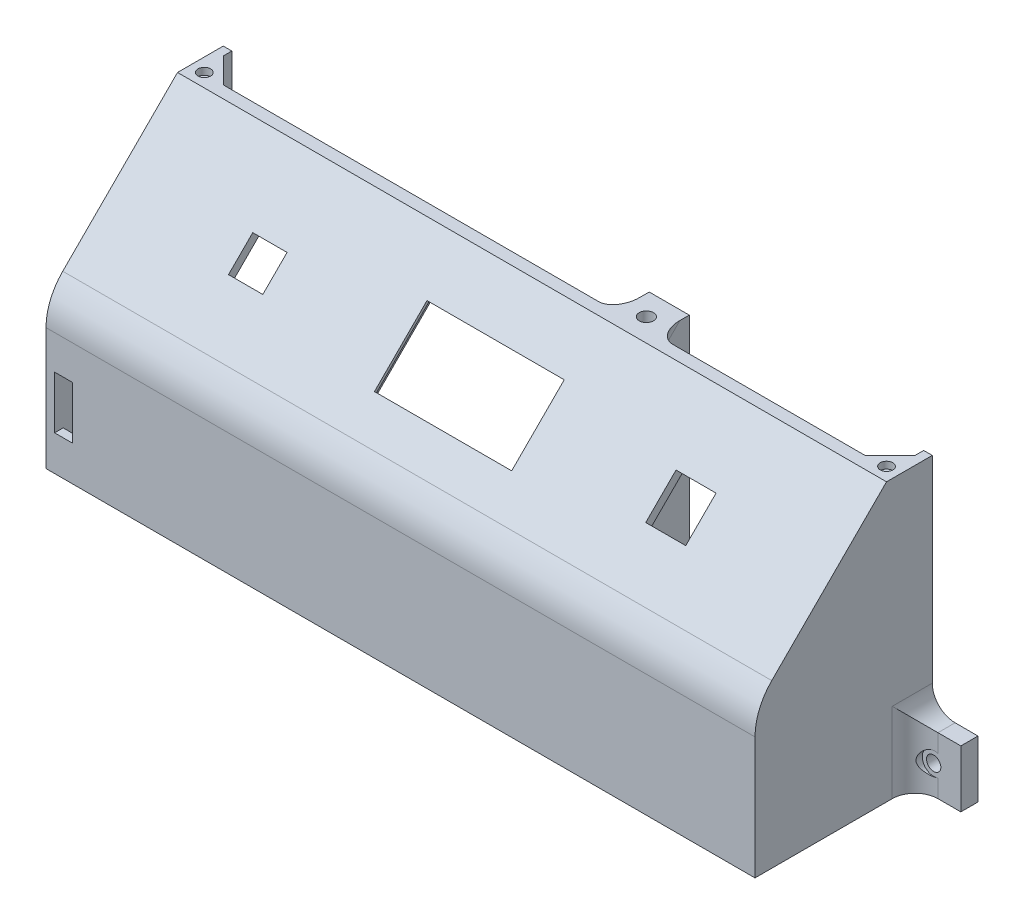
from build123d import *

# Parameters (mm, degrees)
SKETCH1_W           = 124
SKETCH1_H           = 31
BOSS_EXTRUDE1_DEPTH = 50
CUT_EXTRUDE1_DEPTH  = 138.247950804
CUT_EXTRUDE2_DEPTH  = 121
SKETCH4_W           = 2.5
SKETCH4_H           = 5
BOSS_EXTRUDE2_DEPTH = 5
SKETCH5_W           = 24
SKETCH5_H           = 13
SKETCH5_W_2         = 7
SKETCH5_H_2         = 7.5
SKETCH5_W_3         = 6
SKETCH5_H_3         = 6
CUT_EXTRUDE3_DEPTH  = 4
SKETCH6_W           = 3.5
SKETCH6_H           = 19
BOSS_EXTRUDE3_DEPTH = 3.5
SKETCH8_W           = 2.2
SKETCH8_H           = 9
BOSS_EXTRUDE4_DEPTH = 8
FILLET1_R           = 3
SKETCH7_W           = 3.1
SKETCH7_H           = 9.2
CUT_EXTRUDE4_DEPTH  = 8
SKETCH10_W          = 8
SKETCH10_H          = 10
BOSS_EXTRUDE5_DEPTH = 3
FILLET4_R           = 4
SKETCH13_R          = 1.25
CUT_EXTRUDE6_DEPTH  = 5
SKETCH14_R          = 2
CUT_EXTRUDE7_DEPTH  = 5
SKETCH17_W          = 7
SKETCH17_H          = 7
BOSS_EXTRUDE7_DEPTH = 47
SKETCH18_R          = 1.25
CUT_EXTRUDE9_DEPTH  = 5
FILLET5_R           = 3
FILLET6_R           = 10
FILLET8_R           = 3
CUT_EXTRUDE10_DEPTH = 1
SKETCH21_W          = 4.4
SKETCH21_H          = 5
BOSS_EXTRUDE8_DEPTH = 2
CUT_EXTRUDE12_DEPTH = 8
CUT_EXTRUDE13_DEPTH = 1
SKETCH26_R          = 1.1
CUT_EXTRUDE14_DEPTH = 1.2
FILLET10_R          = 1.2


with BuildPart() as part:
    # Sketch1 → Boss-Extrude1 (new body)
    with BuildSketch(Plane(origin=(0, 0, 0), x_dir=(1, 0, 0), z_dir=(0, 1, 0))):
        with Locations((62, 15.5)):
            Rectangle(SKETCH1_W, SKETCH1_H)
    extrude(amount=BOSS_EXTRUDE1_DEPTH)

    # Sketch2 → Cut-Extrude1 (cut, through all)
    with BuildSketch(Plane.ZY):
        Polygon((-23, 48.5), (0, 25.5), (0, 50), (-31, 50), (-31, 48.5), align=None)
    extrude(amount=-CUT_EXTRUDE1_DEPTH, mode=Mode.SUBTRACT)

    # Sketch3 → Cut-Extrude2 (cut)
    with BuildSketch(Plane.ZY.offset(-1.5)):
        Polygon((-31, 48.5), (-25.121320344, 48.5), (-1.5, 24.878679656), (-1.5, 1.5), (-31, 1.5), align=None)
    extrude(amount=-CUT_EXTRUDE2_DEPTH, mode=Mode.SUBTRACT)

    # Sketch4 → Boss-Extrude2 (add)
    with BuildSketch(Plane(origin=(0, 1.5, 0), x_dir=(1, 0, 0), z_dir=(0, 1, 0))):
        Polygon((84, 24), (84, 1.5), (81.5, 1.5), (81.5, 26.5), (122.5, 26.5), (122.5, 24), align=None)
        Polygon((60, 13.5), (60, 22), (29.5, 22), (27, 22), (27, 24.5), (62.5, 24.5), (62.5, 13.5), align=None)
        with Locations((28.25, 4)):
            Rectangle(SKETCH4_W, SKETCH4_H)
    extrude(amount=BOSS_EXTRUDE2_DEPTH)

    # Sketch5 → Cut-Extrude3 (cut)
    with BuildSketch(Plane(origin=(0, 12.75, 12.75), x_dir=(1, 0, 0), z_dir=(0, 0.7071067811865438, 0.7071067811865513))):
        with Locations((62, 35.058134855)):
            Rectangle(SKETCH5_W, SKETCH5_H)
        with Locations((99, 35.058134855)):
            Rectangle(SKETCH5_W_2, SKETCH5_H_2)
        with Locations((25, 35.058134855)):
            Rectangle(SKETCH5_W_3, SKETCH5_H_3)
    extrude(amount=-CUT_EXTRUDE3_DEPTH, mode=Mode.SUBTRACT)

    # Sketch6 → Boss-Extrude3 (add)
    with BuildSketch(Plane(origin=(0, 1.5, 0), x_dir=(1, 0, 0), z_dir=(0, 1, 0))):
        with Locations((7.65, 11)):
            Rectangle(SKETCH6_W, SKETCH6_H)
    extrude(amount=BOSS_EXTRUDE3_DEPTH)

    # Sketch8 → Boss-Extrude4 (add)
    with BuildSketch(Plane(origin=(0, 5, 0), x_dir=(1, 0, 0), z_dir=(0, 1, 0))):
        with Locations((8.3, 14)):
            Rectangle(SKETCH8_W, SKETCH8_H)
    extrude(amount=BOSS_EXTRUDE4_DEPTH)

    # Fillet1
    # the kernel refuses this fillet: 3 mm, written as the material it adds along each edge
    with BuildSketch(Plane(origin=(9.4, 1.5, -20.5), x_dir=(1, 0, 0), z_dir=(0, 0, 1))) as fillet1_piece_1:
        with BuildLine():
            CenterArc((FILLET1_R, FILLET1_R), FILLET1_R, 180, 90)
            Line((0, FILLET1_R), (-FILLET1_R * 0.02, FILLET1_R))
            Line((-FILLET1_R * 0.02, FILLET1_R), (-FILLET1_R * 0.02, -FILLET1_R * 0.02))
            Line((-FILLET1_R * 0.02, -FILLET1_R * 0.02), (FILLET1_R, -FILLET1_R * 0.02))
            Line((FILLET1_R, -FILLET1_R * 0.02), (FILLET1_R, 0))
        make_face()
    extrude(amount=19)
    with BuildSketch(Plane(origin=(7.2, 5, -18.5), x_dir=(0, 0, -1), z_dir=(1, 0, 0))) as fillet1_piece_2:
        with BuildLine():
            CenterArc((3, 2.828427125), FILLET1_R, 180, 70.528779366)
            Line((0, 2.828427125), (-0.06, 2.828427125))
            Line((-0.06, 2.828427125), (-0.06, 0))
            Line((-0.06, 0), (0, -0.06))
            ThreePointArc((0, -0.06), (1, -0.06), (1.98, -0.056568542))
            Line((1.98, -0.056568542), (2, 0))
        make_face()
    extrude(amount=2.2)
    with BuildSketch(Plane(origin=(9.4, 5, -9.5), x_dir=(0, 0, 1), z_dir=(-1, 0, 0))) as fillet1_piece_3:
        with BuildLine():
            CenterArc((FILLET1_R, FILLET1_R), FILLET1_R, 180, 90)
            Line((0, FILLET1_R), (-FILLET1_R * 0.02, FILLET1_R))
            Line((-FILLET1_R * 0.02, FILLET1_R), (-FILLET1_R * 0.02, -FILLET1_R * 0.02))
            Line((-FILLET1_R * 0.02, -FILLET1_R * 0.02), (FILLET1_R, -FILLET1_R * 0.02))
            Line((FILLET1_R, -FILLET1_R * 0.02), (FILLET1_R, 0))
        make_face()
    extrude(amount=2.2)
    with BuildSketch(Plane(origin=(81.5, 1.5, -26.5), x_dir=(0, 0, -1), z_dir=(1, 0, 0))) as fillet1_piece_4:
        with BuildLine():
            CenterArc((FILLET1_R, FILLET1_R), FILLET1_R, 180, 90)
            Line((0, FILLET1_R), (-FILLET1_R * 0.02, FILLET1_R))
            Line((-FILLET1_R * 0.02, FILLET1_R), (-FILLET1_R * 0.02, -FILLET1_R * 0.02))
            Line((-FILLET1_R * 0.02, -FILLET1_R * 0.02), (FILLET1_R, -FILLET1_R * 0.02))
            Line((FILLET1_R, -FILLET1_R * 0.02), (FILLET1_R, 0))
        make_face()
    extrude(amount=41)
    with BuildSketch(Plane(origin=(81.5, 1.5, -1.5), x_dir=(-1, 0, 0), z_dir=(0, 0, -1))) as fillet1_piece_5:
        with BuildLine():
            CenterArc((FILLET1_R, FILLET1_R), FILLET1_R, 180, 90)
            Line((0, FILLET1_R), (-FILLET1_R * 0.02, FILLET1_R))
            Line((-FILLET1_R * 0.02, FILLET1_R), (-FILLET1_R * 0.02, -FILLET1_R * 0.02))
            Line((-FILLET1_R * 0.02, -FILLET1_R * 0.02), (FILLET1_R, -FILLET1_R * 0.02))
            Line((FILLET1_R, -FILLET1_R * 0.02), (FILLET1_R, 0))
        make_face()
    extrude(amount=25)
    with BuildSketch(Plane(origin=(62.5, 1.5, -24.5), x_dir=(1, 0, 0), z_dir=(0, 0, 1))) as fillet1_piece_6:
        with BuildLine():
            CenterArc((FILLET1_R, FILLET1_R), FILLET1_R, 180, 90)
            Line((0, FILLET1_R), (-FILLET1_R * 0.02, FILLET1_R))
            Line((-FILLET1_R * 0.02, FILLET1_R), (-FILLET1_R * 0.02, -FILLET1_R * 0.02))
            Line((-FILLET1_R * 0.02, -FILLET1_R * 0.02), (FILLET1_R, -FILLET1_R * 0.02))
            Line((FILLET1_R, -FILLET1_R * 0.02), (FILLET1_R, 0))
        make_face()
    extrude(amount=11)
    with BuildSketch(Plane(origin=(27, 1.5, -24.5), x_dir=(0, 0, -1), z_dir=(1, 0, 0))) as fillet1_piece_7:
        with BuildLine():
            CenterArc((FILLET1_R, FILLET1_R), FILLET1_R, 180, 90)
            Line((0, FILLET1_R), (-FILLET1_R * 0.02, FILLET1_R))
            Line((-FILLET1_R * 0.02, FILLET1_R), (-FILLET1_R * 0.02, -FILLET1_R * 0.02))
            Line((-FILLET1_R * 0.02, -FILLET1_R * 0.02), (FILLET1_R, -FILLET1_R * 0.02))
            Line((FILLET1_R, -FILLET1_R * 0.02), (FILLET1_R, 0))
        make_face()
    extrude(amount=35.5)
    with BuildSketch(Plane(origin=(27, 1.5, -22), x_dir=(-1, 0, 0), z_dir=(0, 0, -1))) as fillet1_piece_8:
        with BuildLine():
            CenterArc((FILLET1_R, FILLET1_R), FILLET1_R, 180, 90)
            Line((0, FILLET1_R), (-FILLET1_R * 0.02, FILLET1_R))
            Line((-FILLET1_R * 0.02, FILLET1_R), (-FILLET1_R * 0.02, -FILLET1_R * 0.02))
            Line((-FILLET1_R * 0.02, -FILLET1_R * 0.02), (FILLET1_R, -FILLET1_R * 0.02))
            Line((FILLET1_R, -FILLET1_R * 0.02), (FILLET1_R, 0))
        make_face()
    extrude(amount=2.5)
    with BuildSketch(Plane(origin=(27, 1.5, -6.5), x_dir=(-1, 0, 0), z_dir=(0, 0, 1))) as fillet1_piece_9:
        with BuildLine():
            CenterArc((FILLET1_R, -FILLET1_R), FILLET1_R, 90, 90)
            Line((0, -FILLET1_R), (-FILLET1_R * 0.02, -FILLET1_R))
            Line((-FILLET1_R * 0.02, -FILLET1_R), (-FILLET1_R * 0.02, FILLET1_R * 0.02))
            Line((-FILLET1_R * 0.02, FILLET1_R * 0.02), (FILLET1_R, FILLET1_R * 0.02))
            Line((FILLET1_R, FILLET1_R * 0.02), (FILLET1_R, 0))
        make_face()
    extrude(amount=5)
    with BuildSketch(Plane(origin=(74, 1.5, -26.5), x_dir=(0, 0, -1), z_dir=(1, 0, 0))) as fillet1_piece_10a_section:
        with BuildLine():
            CenterArc((FILLET1_R, FILLET1_R), FILLET1_R, 180, 90)
            Line((0, FILLET1_R), (-FILLET1_R * 0.02, FILLET1_R))
            Line((-FILLET1_R * 0.02, FILLET1_R), (-FILLET1_R * 0.02, -FILLET1_R * 0.02))
            Line((-FILLET1_R * 0.02, -FILLET1_R * 0.02), (FILLET1_R, -FILLET1_R * 0.02))
            Line((FILLET1_R, -FILLET1_R * 0.02), (FILLET1_R, 0))
        make_face()
    fillet1_piece_10a = extrude(amount=48.5, mode=Mode.PRIVATE)
    fillet1_piece_10a = split(fillet1_piece_10a, bisect_by=Plane(origin=(81.5, 2.179185343, -27.179185343), z_dir=(-1, 0, 0)), keep=Keep.TOP, mode=Mode.PRIVATE)
    with BuildSketch(Plane(origin=(81.5, 1.5, -1.5), x_dir=(-1, 0, 0), z_dir=(0, 0, -1))) as fillet1_piece_10b_section:
        with BuildLine():
            CenterArc((FILLET1_R, FILLET1_R), FILLET1_R, 180, 90)
            Line((0, FILLET1_R), (-FILLET1_R * 0.02, FILLET1_R))
            Line((-FILLET1_R * 0.02, FILLET1_R), (-FILLET1_R * 0.02, -FILLET1_R * 0.02))
            Line((-FILLET1_R * 0.02, -FILLET1_R * 0.02), (FILLET1_R, -FILLET1_R * 0.02))
            Line((FILLET1_R, -FILLET1_R * 0.02), (FILLET1_R, 0))
        make_face()
    fillet1_piece_10b = extrude(amount=32.5, mode=Mode.PRIVATE)
    fillet1_piece_10b = split(fillet1_piece_10b, bisect_by=Plane(origin=(80.820814657, 2.179185343, -31), z_dir=(0, 0, 1)), keep=Keep.TOP, mode=Mode.PRIVATE)
    fillet1_piece_10b = split(fillet1_piece_10b, bisect_by=Plane(origin=(80.820814657, 2.179185343, -26.5), z_dir=(0, 0, -1)), keep=Keep.TOP, mode=Mode.PRIVATE)
    fillet1_piece_10 = fillet1_piece_10a & fillet1_piece_10b
    add(fillet1_piece_10)
    with BuildSketch(Plane(origin=(62.5, 1.5, -32), x_dir=(1, 0, 0), z_dir=(0, 0, 1))) as fillet1_piece_11a_section:
        with BuildLine():
            CenterArc((FILLET1_R, FILLET1_R), FILLET1_R, 180, 90)
            Line((0, FILLET1_R), (-FILLET1_R * 0.02, FILLET1_R))
            Line((-FILLET1_R * 0.02, FILLET1_R), (-FILLET1_R * 0.02, -FILLET1_R * 0.02))
            Line((-FILLET1_R * 0.02, -FILLET1_R * 0.02), (FILLET1_R, -FILLET1_R * 0.02))
            Line((FILLET1_R, -FILLET1_R * 0.02), (FILLET1_R, 0))
        make_face()
    fillet1_piece_11a = extrude(amount=18.5, mode=Mode.PRIVATE)
    fillet1_piece_11a = split(fillet1_piece_11a, bisect_by=Plane(origin=(63.179185343, 2.179185343, -31), z_dir=(0, 0, 1)), keep=Keep.TOP, mode=Mode.PRIVATE)
    fillet1_piece_11a = split(fillet1_piece_11a, bisect_by=Plane(origin=(63.179185343, 2.179185343, -24.5), z_dir=(0, 0, -1)), keep=Keep.TOP, mode=Mode.PRIVATE)
    with BuildSketch(Plane(origin=(27, 1.5, -24.5), x_dir=(0, 0, -1), z_dir=(1, 0, 0))) as fillet1_piece_11b_section:
        with BuildLine():
            CenterArc((FILLET1_R, FILLET1_R), FILLET1_R, 180, 90)
            Line((0, FILLET1_R), (-FILLET1_R * 0.02, FILLET1_R))
            Line((-FILLET1_R * 0.02, FILLET1_R), (-FILLET1_R * 0.02, -FILLET1_R * 0.02))
            Line((-FILLET1_R * 0.02, -FILLET1_R * 0.02), (FILLET1_R, -FILLET1_R * 0.02))
            Line((FILLET1_R, -FILLET1_R * 0.02), (FILLET1_R, 0))
        make_face()
    fillet1_piece_11b = extrude(amount=43, mode=Mode.PRIVATE)
    fillet1_piece_11b = split(fillet1_piece_11b, bisect_by=Plane(origin=(62.5, 2.179185343, -25.179185343), z_dir=(1, 0, 0)), keep=Keep.TOP, mode=Mode.PRIVATE)
    fillet1_piece_11 = fillet1_piece_11a & fillet1_piece_11b
    add(fillet1_piece_11)
    with BuildSketch(Plane(origin=(19.5, 1.5, -24.5), x_dir=(0, 0, -1), z_dir=(1, 0, 0))) as fillet1_piece_12a_section:
        with BuildLine():
            CenterArc((FILLET1_R, FILLET1_R), FILLET1_R, 180, 90)
            Line((0, FILLET1_R), (-FILLET1_R * 0.02, FILLET1_R))
            Line((-FILLET1_R * 0.02, FILLET1_R), (-FILLET1_R * 0.02, -FILLET1_R * 0.02))
            Line((-FILLET1_R * 0.02, -FILLET1_R * 0.02), (FILLET1_R, -FILLET1_R * 0.02))
            Line((FILLET1_R, -FILLET1_R * 0.02), (FILLET1_R, 0))
        make_face()
    fillet1_piece_12a = extrude(amount=43, mode=Mode.PRIVATE)
    fillet1_piece_12a = split(fillet1_piece_12a, bisect_by=Plane(origin=(27, 2.179185343, -25.179185343), z_dir=(-1, 0, 0)), keep=Keep.TOP, mode=Mode.PRIVATE)
    with BuildSketch(Plane(origin=(27, 1.5, -22), x_dir=(-1, 0, 0), z_dir=(0, 0, -1))) as fillet1_piece_12b_section:
        with BuildLine():
            CenterArc((FILLET1_R, FILLET1_R), FILLET1_R, 180, 90)
            Line((0, FILLET1_R), (-FILLET1_R * 0.02, FILLET1_R))
            Line((-FILLET1_R * 0.02, FILLET1_R), (-FILLET1_R * 0.02, -FILLET1_R * 0.02))
            Line((-FILLET1_R * 0.02, -FILLET1_R * 0.02), (FILLET1_R, -FILLET1_R * 0.02))
            Line((FILLET1_R, -FILLET1_R * 0.02), (FILLET1_R, 0))
        make_face()
    fillet1_piece_12b = extrude(amount=10, mode=Mode.PRIVATE)
    fillet1_piece_12b = split(fillet1_piece_12b, bisect_by=Plane(origin=(26.320814657, 2.179185343, -31), z_dir=(0, 0, 1)), keep=Keep.TOP, mode=Mode.PRIVATE)
    fillet1_piece_12b = split(fillet1_piece_12b, bisect_by=Plane(origin=(26.320814657, 2.179185343, -24.5), z_dir=(0, 0, -1)), keep=Keep.TOP, mode=Mode.PRIVATE)
    fillet1_piece_12 = fillet1_piece_12a & fillet1_piece_12b
    add(fillet1_piece_12)

    # Sketch7 → Cut-Extrude4 (cut)
    with BuildSketch(Plane(origin=(0, 0, -1.5), x_dir=(-1, 0, 0), z_dir=(0, 0, -1))):
        with Locations((-3.05, 10.77)):
            Rectangle(SKETCH7_W, SKETCH7_H)
    extrude(amount=-CUT_EXTRUDE4_DEPTH, mode=Mode.SUBTRACT)

    # Sketch10 → Boss-Extrude5 (add)
    with BuildSketch(Plane(origin=(0, 0, -31), x_dir=(-1, 0, 0), z_dir=(0, 0, -1))):
        with Locations((-128, 5)):
            Rectangle(SKETCH10_W, SKETCH10_H)
        with Locations((4, 5)):
            Rectangle(SKETCH10_W, SKETCH10_H)
    extrude(amount=-BOSS_EXTRUDE5_DEPTH)

    # Fillet4
    fillet4_edges = [part.edges().sort_by_distance(p)[0] for p in [
        (124, 5, -28),
        (124, 10, -29.5),
        (0, 5, -28),
        (0, 10, -29.5),
    ]]
    fillet(fillet4_edges, radius=FILLET4_R)

    # Sketch13 → Cut-Extrude6 (cut)
    with BuildSketch(Plane(origin=(0, 0, -31), x_dir=(-1, 0, 0), z_dir=(0, 0, -1))):
        with Locations((3.25, 5)):
            Circle(SKETCH13_R)
        with Locations((-127.25, 5)):
            Circle(SKETCH13_R)
    extrude(amount=-CUT_EXTRUDE6_DEPTH, mode=Mode.SUBTRACT)

    # Sketch14 → Cut-Extrude7 (cut)
    with BuildSketch(Plane.XY.offset(-28)):
        with Locations((-3.25, 5)):
            Circle(SKETCH14_R)
        with Locations((127.25, 5)):
            Circle(SKETCH14_R)
    extrude(amount=CUT_EXTRUDE7_DEPTH, mode=Mode.SUBTRACT)

    # Sketch17 → Boss-Extrude7 (add, through all)
    with BuildSketch(Plane(origin=(0, 1.5, 0), x_dir=(1, 0, 0), z_dir=(0, 1, 0))):
        with Locations((78, 27.5)):
            Rectangle(SKETCH17_W, SKETCH17_H)
    extrude(amount=BOSS_EXTRUDE7_DEPTH)

    # Sketch18 → Cut-Extrude9 (cut)
    with BuildSketch(Plane(origin=(0, 48.5, 0), x_dir=(1, 0, 0), z_dir=(0, 1, 0))):
        with Locations(Location((78, 27, 0), (0, 0, 270))):
            Circle(SKETCH18_R)
    extrude(amount=-CUT_EXTRUDE9_DEPTH, mode=Mode.SUBTRACT)

    # Fillet5
    fillet5_edges = [part.edges().sort_by_distance(p)[0] for p in [
        (74.5, 47.939339828, -24.560660172),
        (81.5, 47.939339828, -24.560660172),
        (81.5, 5.5, -24),
        (80.621320344, 2.378679656, -24),
        (76.5, 1.5, -24),
        (74.5, 1.5, -27.5),
    ]]
    fillet(fillet5_edges, radius=FILLET5_R)

    # Fillet6
    fillet6_edges = [part.edges().sort_by_distance(p)[0] for p in [
        (62, 25.5, 0),
    ]]
    fillet(fillet6_edges, radius=FILLET6_R)

    # Fillet8
    fillet8_edges = [part.edges().sort_by_distance(p)[0] for p in [
        (122.5, 36.689339828, -13.310660172),
        (62, 24.878679656, -1.5),
    ]]
    fillet(fillet8_edges, radius=FILLET8_R)

    # Sketch19 → Cut-Extrude10 (cut)
    with BuildSketch(Plane(origin=(0, 11.689339828, 11.689339828), x_dir=(1, 0, 0), z_dir=(0, -0.7071067811865438, -0.7071067811865513))):
        Polygon((74.5, -41.558134855), (68, -41.558134855), (68, -46.558134855), (56, -46.558134855), (56, -41.558134855), (49.5, -41.558134855), (49.5, -24.558134855), (55.5, -24.558134855), (55.5, -19.895183951), (68.5, -19.895183951), (68.5, -24.558134855), (74.5, -24.558134855), align=None)
    extrude(amount=-CUT_EXTRUDE10_DEPTH, mode=Mode.SUBTRACT)

    # Sketch21 → Boss-Extrude8 (add)
    with BuildSketch(Plane(origin=(0, 1.5, 0), x_dir=(1, 0, 0), z_dir=(0, 1, 0))):
        with Locations((3.7, 28.5)):
            Rectangle(SKETCH21_W, SKETCH21_H)
    extrude(amount=BOSS_EXTRUDE8_DEPTH)

    # Sketch22 → Cut-Extrude12 (cut)
    with BuildSketch(Plane(origin=(1.5, 0, 0), x_dir=(0, 0, -1), z_dir=(1, 0, 0))):
        with BuildLine():
            Line((17.2, 1.5), (17.8, 1.5))
            ThreePointArc((17.8, 1.5), (20.41629509, 2.58370491), (21.5, 5.2))
            Line((21.5, 5.2), (21.5, 21.8))
            ThreePointArc((21.5, 21.8), (20.41629509, 24.41629509), (17.8, 25.5))
            Line((17.8, 25.5), (17.2, 25.5))
            ThreePointArc((17.2, 25.5), (14.58370491, 24.41629509), (13.5, 21.8))
            Line((13.5, 21.8), (13.5, 5.2))
            ThreePointArc((13.5, 5.2), (14.58370491, 2.58370491), (17.2, 1.5))
        make_face()
    extrude(amount=-CUT_EXTRUDE12_DEPTH, mode=Mode.SUBTRACT)

    # Sketch23 → Cut-Extrude13 (cut)
    with BuildSketch(Plane(origin=(0, 1.5, 0), x_dir=(1, 0, 0), z_dir=(0, 1, 0))):
        Polygon((117.5, 4.5), (89, 4.5), (87, 6.5), (87, 19), (89, 21), (117.5, 21), (119.5, 19), (119.5, 6.5), align=None)
        Polygon((24, 21), (24, 25.5), (22, 27.5), (16.4, 27.5), (14.4, 25.5), (14.4, 6.5), (16.4, 4.5), (24, 4.5), (24, 7.5), (26, 9.5), (30.5, 9.5), (32.5, 7.5), (32.5, 6.5), (34.5, 4.5), (55, 4.5), (57, 6.5), (57, 17), (55, 19), (31.418492094, 19), (26, 19), align=None)
        Polygon((73.5, 18), (67.5, 18), (65.5, 16), (65.5, 6.5), (67.5, 4.5), (73.5, 4.5), (75.5, 6.5), (75.5, 16), align=None)
    extrude(amount=-CUT_EXTRUDE13_DEPTH, mode=Mode.SUBTRACT)

    # Sketch25 → Loft2 section 0
    with BuildSketch(Plane(origin=(0, 23.636038969, 0), x_dir=(1, 0, 0), z_dir=(0, 1, 0))):
        with BuildLine():
            Line((0, 0.320851619), (1.5, 0.320851619))
            Line((1.5, 0.320851619), (0, 1.5))
            Line((0, 1.5), (0, 0.320851619))
        make_face()
    # Sketch24 → Loft2 section 1
    with BuildSketch(Plane(origin=(0, 48.5, 0), x_dir=(1, 0, 0), z_dir=(0, 1, 0))):
        with BuildLine():
            Line((0, 31), (0, 23))
            Line((0, 23), (8, 23))
            Line((8, 23), (0, 31))
        make_face()
    loft2 = loft()

    # Sketch26 → Cut-Extrude14 (cut)
    with BuildSketch(Plane(origin=(0, 48.5, 0), x_dir=(1, 0, 0), z_dir=(0, 1, 0))):
        with Locations(Location((2.343145751, 25.343145751, 0), (0, 0, 270))):
            Circle(SKETCH26_R)
    cut_extrude14 = extrude(amount=-CUT_EXTRUDE14_DEPTH, mode=Mode.SUBTRACT)

    # Mirror1: Loft2, Cut-Extrude14 across plane
    add(loft2.mirror(Plane(origin=(62, 0, 0), x_dir=(0, 0, 1), z_dir=(1, 0, 0))))
    add(cut_extrude14.mirror(Plane(origin=(62, 0, 0), x_dir=(0, 0, 1), z_dir=(1, 0, 0))), mode=Mode.SUBTRACT)

    # Fillet10
    fillet10_edges = [part.edges().sort_by_distance(p)[0] for p in [
        (78, 47.378679656, -24),
    ]]
    fillet(fillet10_edges, radius=FILLET10_R)


solid = part.part
